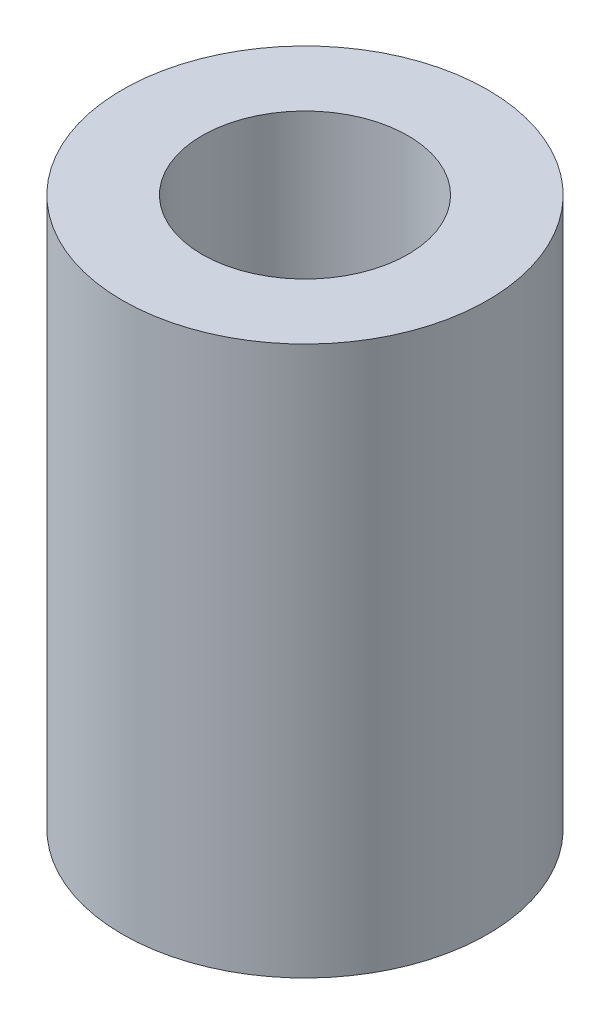
from build123d import *

# Parameters (mm, degrees)
SKETCH1_R           = 2.66
SKETCH1_R_2         = 1.5
BOSS_EXTRUDE1_DEPTH = 8


with BuildPart() as part:
    # Sketch1 → Boss-Extrude1 (new body)
    with BuildSketch(Plane(origin=(0, 0, 0), x_dir=(1, 0, 0), z_dir=(0, 1, 0))):
        Circle(SKETCH1_R)
        Circle(SKETCH1_R_2, mode=Mode.SUBTRACT)
    extrude(amount=BOSS_EXTRUDE1_DEPTH)


solid = part.part
